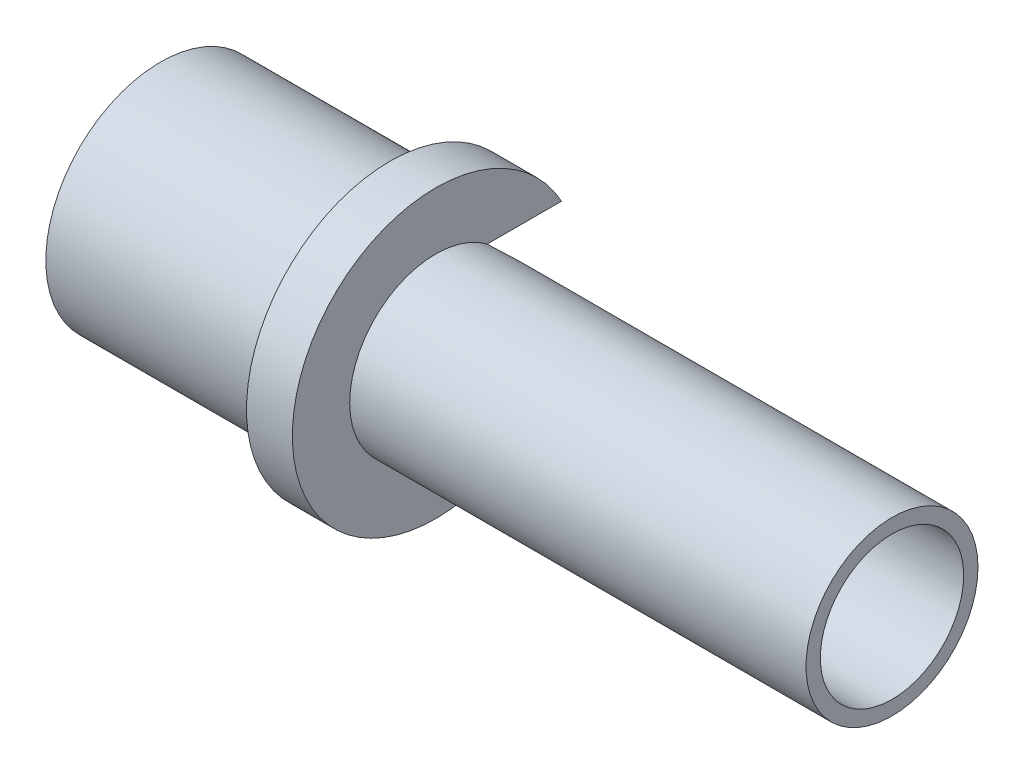
from build123d import *

# Parameters (mm, degrees)
CUT_EXTRUDE2_REACH = 41.719


with BuildPart() as part:
    # Sketch1 → Revolve1 (revolve)
    with BuildSketch(Plane.XY):
        Polygon((2.41, 3.96875), (2.41, 4.7625), (-22.86, 4.7625), (-22.86, 7.9375), (-25.4, 7.9375), (-25.4, 6.35), (-38.1, 6.35), (-38.1, 3.96875), align=None)
    revolve(axis=Axis((0, 0, 0), (-1, 0, 0)))

    # Sketch3 → Cut-Extrude2 (cut, up to next)
    with BuildSketch(Plane.XY, mode=Mode.PRIVATE) as cut_extrude2_sk1:
        with BuildLine():
            Line((-38.1, 3.81), (-38.1, -3.81))
            Line((-38.1, -3.81), (-22.86, -3.81))
            ThreePointArc((-22.86, -3.81), (-20.61493597, -2.88006403), (-19.685, -0.635))
            Line((-19.685, -0.635), (-19.685, 0.635))
            ThreePointArc((-19.685, 0.635), (-20.61493597, 2.88006403), (-22.86, 3.81))
            Line((-22.86, 3.81), (-38.1, 3.81))
        make_face()
    cut_extrude2_tool1 = extrude(cut_extrude2_sk1.sketch, amount=-CUT_EXTRUDE2_REACH, mode=Mode.PRIVATE) & part.part
    add(cut_extrude2_tool1.solids().sort_by_distance((-29.16287, 0, 0))[0], mode=Mode.SUBTRACT)


solid = part.part
